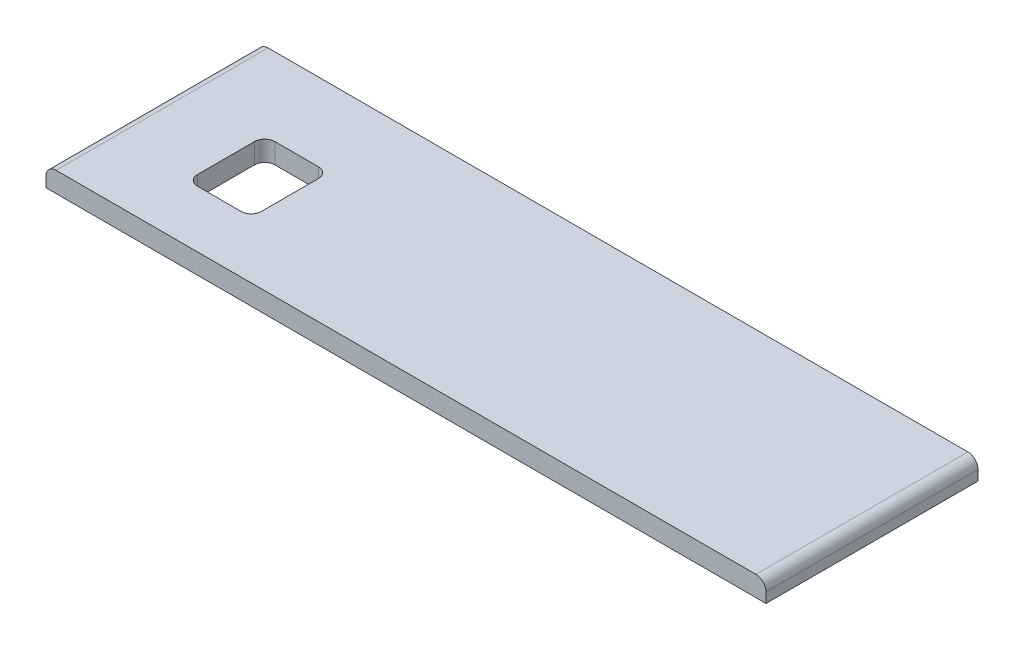
from build123d import *

# Parameters (mm, degrees)
SKETCH_1_W                        = 107
SKETCH_1_H                        = 31.5
SKETCH_1_W_2                      = 9.5
SKETCH_1_H_2                      = 11.5
EXTRUDE_1_DEPTH                   = 3
TOOL_D3_R1P5_POWER_CORNERS_R      = 1.5
TOOL_D3_R1P5_REAR_OUTER_CORNERS_R = 1.5


with BuildPart() as part:
    # Эскиз1 → Бобышка-Вытянуть1 (new body)
    with BuildSketch(Plane(origin=(0, 0, 0), x_dir=(1, 0, 0), z_dir=(0, 1, 0))):
        with Locations((53.5, -15.75)):
            Rectangle(SKETCH_1_W, SKETCH_1_H)
        with Locations((17.3, -17.3)):
            Rectangle(SKETCH_1_W_2, SKETCH_1_H_2, mode=Mode.SUBTRACT)
    extrude(amount=EXTRUDE_1_DEPTH)

    # tool_D3_R1p5_power_corners
    tool_d3_r1p5_power_corners_edges = [part.edges().sort_by_distance(p)[0] for p in [
        (12.55, 1.5, 11.55),
        (22.05, 1.5, 11.55),
        (22.05, 1.5, 23.05),
        (12.55, 1.5, 23.05),
    ]]
    fillet(tool_d3_r1p5_power_corners_edges, radius=TOOL_D3_R1P5_POWER_CORNERS_R)

    # tool_D3_R1p5_rear_outer_corners
    tool_d3_r1p5_rear_outer_corners_edges = [part.edges().sort_by_distance(p)[0] for p in [
        (0, 3, 15.75),
        (107, 3, 15.75),
    ]]
    fillet(tool_d3_r1p5_rear_outer_corners_edges, radius=TOOL_D3_R1P5_REAR_OUTER_CORNERS_R)


solid = part.part
